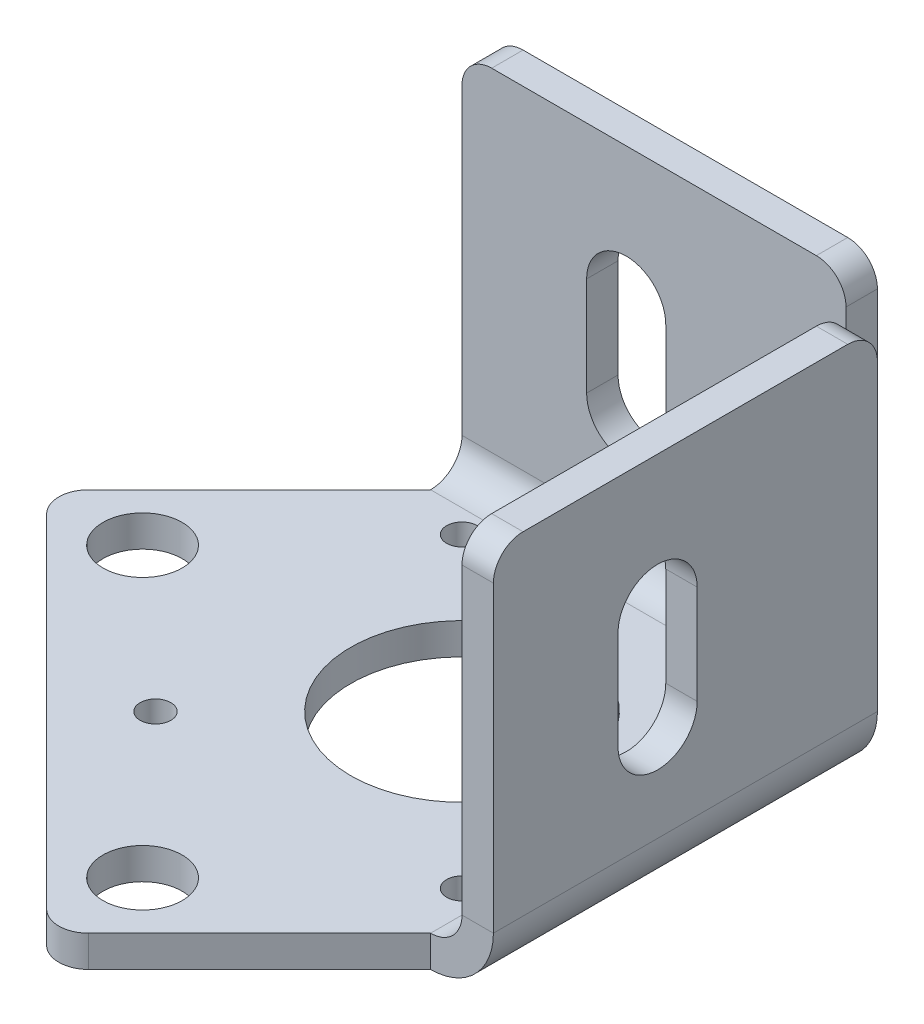
from build123d import *

# Parameters (mm, degrees)
SKETCH2_W                    = 42
SKETCH2_H                    = 42
BOSS_EXTRUDE1_DEPTH          = 3.175
SKETCH3_R                    = 11.25
SKETCH3_R_2                  = 1.554126588
CUT_EXTRUDE1_DEPTH           = 3.175
EDGE_FLANGE3_STRIP_W         = 19.05
EDGE_FLANGE3_STRIP_H         = 3.175
EDGE_FLANGE3_STRIP_CUT_DEPTH = 42
EDGE_FLANGE3_DEPTH           = 42
EDGE_FLANGE4_START           = -24.175
EDGE_FLANGE4_OUTLINE_W       = 3.175
EDGE_FLANGE4_OUTLINE_H       = 6.35
EDGE_FLANGE4_DEPTH           = 6.35
EDGE_FLANGE4_START_2         = -17.825
EDGE_FLANGE4_2_DEPTH         = 38.825
EDGE_FLANGE4_3_DEPTH         = 38.825
SKETCH22_W                   = 3.175
SKETCH22_H                   = 33.65
CUT_EXTRUDE2_DEPTH           = 3.175
SKETCH23_R                   = 4
BOSS_EXTRUDE2_DEPTH          = 3.175
CUT_EXTRUDE3_REACH           = 88.051
FILLET1_R                    = 3


# Read off the part's stored shape, not the designer's step: Edge-Flange4
# Sheet-metal steps are written as plain solids
with BuildPart() as part:
    # Sketch2 → Boss-Extrude1 (new body)
    with BuildSketch(Plane(origin=(0, 0, 0), x_dir=(1, 0, 0), z_dir=(0, 1, 0))):
        Rectangle(SKETCH2_W, SKETCH2_H)
    extrude(amount=BOSS_EXTRUDE1_DEPTH)

    # Sketch3 → Cut-Extrude1 (cut)
    with BuildSketch(Plane(origin=(0, 3.175, 0), x_dir=(1, 0, 0), z_dir=(0, 1, 0))):
        with Locations(Location((0, 0, 0), (0, 0, 270))):
            Circle(SKETCH3_R)
        with Locations(Location((-15.494, 15.494, 0), (0, 0, 270))):
            Circle(SKETCH3_R_2)
        with Locations(Location((15.494, 15.494, 0), (0, 0, 270))):
            Circle(SKETCH3_R_2)
        with Locations(Location((15.494, -15.494, 0), (0, 0, 270))):
            Circle(SKETCH3_R_2)
        with Locations(Location((-15.494, -15.494, 0), (0, 0, 270))):
            Circle(SKETCH3_R_2)
    extrude(amount=-CUT_EXTRUDE1_DEPTH, mode=Mode.SUBTRACT)

    # Edge-Flange3 strip (across the edge) → Edge-Flange3 strip cut (cut)
    with BuildSketch(Plane(origin=(21, 3.175, -21), x_dir=(0, 0, 1), z_dir=(-1, 0, 0))):
        with Locations((-6.35, -1.5875)):
            Rectangle(EDGE_FLANGE3_STRIP_W, EDGE_FLANGE3_STRIP_H)
    extrude(amount=EDGE_FLANGE3_STRIP_CUT_DEPTH, mode=Mode.SUBTRACT)

    # Edge-Flange3 section (across the edge) → Edge-Flange3 (add)
    with BuildSketch(Plane(origin=(21, 3.175, -21), x_dir=(0, 0, 1), z_dir=(-1, 0, 0))):
        with BuildLine():
            Line((-3.175, 3.175), (-3.175, 36.825))
            Line((-3.175, 36.825), (0, 36.825))
            Line((0, 36.825), (0, 3.175))
            ThreePointArc((0, 3.175), (0.92993597, 0.92993597), (3.175, 0))
            Line((3.175, 0), (3.175, -3.175))
            ThreePointArc((3.175, -3.175), (-1.315128061, -1.315128061), (-3.175, 3.175))
        make_face()
    extrude(amount=EDGE_FLANGE3_DEPTH)

    # Edge-Flange4 outline → Edge-Flange4 (cut)
    with BuildSketch(Plane.XY.offset(EDGE_FLANGE4_START)):
        with Locations((19.4125, 3.175)):
            Rectangle(EDGE_FLANGE4_OUTLINE_W, EDGE_FLANGE4_OUTLINE_H)
    extrude(amount=EDGE_FLANGE4_DEPTH, mode=Mode.SUBTRACT)

    # Edge-Flange4 2 outline → Edge-Flange4 2 (cut)
    with BuildSketch(Plane.XY.offset(EDGE_FLANGE4_START_2)):
        with BuildLine():
            ThreePointArc((21, 0.850738685), (19.468500936, 0.216371003), (17.825, 0))
            Line((17.825, 0), (21, 0))
            Line((21, 0), (21, 0.850738685))
        make_face()
    extrude(amount=EDGE_FLANGE4_2_DEPTH, mode=Mode.SUBTRACT)

    # Edge-Flange4 3 outline → Edge-Flange4 3 (add)
    with BuildSketch(Plane.XY.offset(EDGE_FLANGE4_START_2)):
        with BuildLine():
            Line((17.825, 3.175), (21, 3.175))
            Line((21, 3.175), (21, 0.850738685))
            ThreePointArc((21, 0.850738685), (23.324261314, 3.174999999), (24.175, 6.35))
            Line((24.175, 6.35), (24.175, 40))
            Line((24.175, 40), (21, 40))
            Line((21, 40), (21, 6.35))
            ThreePointArc((21, 6.35), (20.07006403, 4.10493597), (17.825, 3.175))
        make_face()
    extrude(amount=EDGE_FLANGE4_3_DEPTH)

    # Sketch22 → Cut-Extrude2 (cut)
    with BuildSketch(Plane(origin=(0, 0, -24.175), x_dir=(-1, 0, 0), z_dir=(0, 0, -1))):
        with Locations((-19.4125, 23.175)):
            Rectangle(SKETCH22_W, SKETCH22_H)
    extrude(amount=-CUT_EXTRUDE2_DEPTH, mode=Mode.SUBTRACT)

    # Sketch23 → Boss-Extrude2 (add)
    # profile 1 of 2: a face of its own
    with BuildSketch(Plane(origin=(0, 3.175, 0), x_dir=(1, 0, 0), z_dir=(0, 1, 0))):
        Polygon((-21, -21), (-21, 17.825), (-40.4125, -1.5875), align=None)
        with Locations(Location((-30.70625, -1.5875, 0), (0, 0, 270))):
            Circle(SKETCH23_R, mode=Mode.SUBTRACT)
    # profile 2 of 2: a face of its own
    with BuildSketch(Plane(origin=(0, 3.175, 0), x_dir=(1, 0, 0), z_dir=(0, 1, 0))):
        Polygon((17.825, -21), (-21, -21), (-1.5875, -40.4125), align=None)
        with Locations(Location((-1.5875, -30.70625, 0), (0, 0, 270))):
            Circle(SKETCH23_R, mode=Mode.SUBTRACT)
    extrude(amount=-BOSS_EXTRUDE2_DEPTH)

    # Sketch24 → Cut-Extrude3 (cut, up to next)
    with BuildSketch(Plane(origin=(0, 0, -24.175), x_dir=(-1, 0, 0), z_dir=(0, 0, -1)), mode=Mode.PRIVATE) as cut_extrude3_sk1:
        with BuildLine():
            Line((0.4, 16.35), (0.4, 26.35))
            ThreePointArc((0.4, 26.35), (4.4, 30.35), (8.4, 26.35))
            Line((8.4, 26.35), (8.4, 16.35))
            ThreePointArc((8.4, 16.35), (4.4, 12.35), (0.4, 16.35))
        make_face()
    cut_extrude3_tool1 = extrude(cut_extrude3_sk1.sketch, amount=-CUT_EXTRUDE3_REACH, mode=Mode.PRIVATE) & part.part
    cut_extrude3 = cut_extrude3_tool1.solids().sort_by_distance((-4.4, 21.35, -24.175))[0]
    add(cut_extrude3, mode=Mode.SUBTRACT)

    # Mirror1: Cut-Extrude3 across plane
    add(cut_extrude3.mirror(Plane(origin=(0, 0, 0), x_dir=(-0.7071067811865478, 2.4649279095086426e-15, 0.7071067811865472), z_dir=(-0.7071067811865475, 2.4649279095086418e-15, -0.7071067811865477))), mode=Mode.SUBTRACT)

    # Fillet1
    fillet1_edges = [part.edges().sort_by_distance(p)[0] for p in [
        (-40.4125, 1.5875, 1.5875),
        (-1.5875, 1.5875, 40.4125),
        (-21, 40, -22.5875),
        (22.5875, 40, 21),
        (22.5875, 40, -17.825),
        (17.825, 40, -22.5875),
    ]]
    fillet(fillet1_edges, radius=FILLET1_R)


solid = part.part
